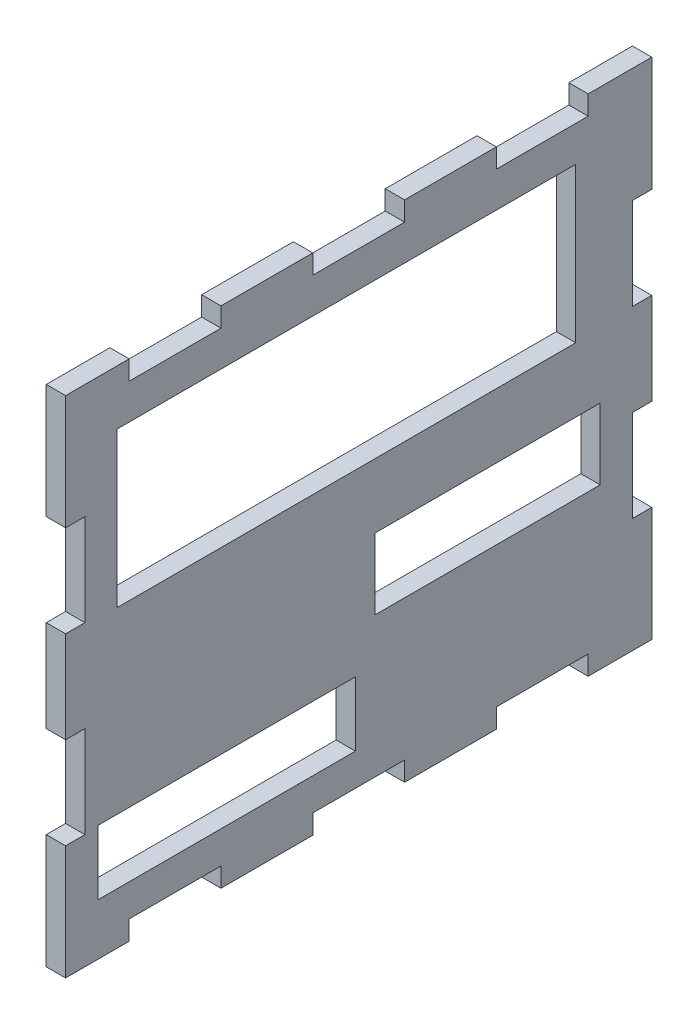
from build123d import *

# Parameters (mm, degrees)
BOSS_EXTRUDE1_DEPTH = 3
SKETCH2_W           = 71.2
SKETCH2_H           = 24
SKETCH2_W_2         = 35
SKETCH2_H_2         = 11
SKETCH2_W_3         = 40
SKETCH2_H_3         = 10
CUT_EXTRUDE1_DEPTH  = 3


with BuildPart() as part:
    # Sketch1 → Boss-Extrude1 (new body)
    with BuildSketch(Plane(origin=(0, 0, 0), x_dir=(0, 0, -1), z_dir=(1, 0, 0))):
        Polygon((-46.800460417, 37.069263333), (-46.800460417, 19.294263333), (-43.800460417, 19.294263333), (-43.800460417, 5.044263333), (-46.800460417, 5.044263333), (-46.800460417, -9.205736667), (-43.800460417, -9.205736667), (-43.800460417, -23.455736667), (-46.800460417, -23.455736667), (-46.800460417, -37.705736667), (-46.800460417, -41.230736667), (-36.925460417, -41.230736667), (-36.925460417, -38.230736667), (-22.675460417, -38.230736667), (-22.675460417, -41.230736667), (-8.425460417, -41.230736667), (-8.425460417, -38.230736667), (5.824539583, -38.230736667), (5.824539583, -41.230736667), (20.074539583, -41.230736667), (20.074539583, -38.230736667), (34.324539583, -38.230736667), (34.324539583, -41.230736667), (44.199539583, -41.230736667), (44.199539583, -23.455736667), (41.199539583, -23.455736667), (41.199539583, -9.205736667), (44.199539583, -9.205736667), (44.199539583, 5.044263333), (41.199539583, 5.044263333), (41.199539583, 19.294263333), (44.199539583, 19.294263333), (44.199539583, 33.544263333), (44.199539583, 37.069263333), (34.324539583, 37.069263333), (34.324539583, 34.069263333), (20.074539583, 34.069263333), (20.074539583, 37.069263333), (5.824539583, 37.069263333), (5.824539583, 34.069263333), (-8.425460417, 34.069263333), (-8.425460417, 37.069263333), (-22.675460417, 37.069263333), (-22.675460417, 34.069263333), (-36.925460417, 34.069263333), (-36.925460417, 37.069263333), align=None)
    extrude(amount=BOSS_EXTRUDE1_DEPTH)

    # Sketch2 → Cut-Extrude1 (cut)
    with BuildSketch(Plane(origin=(3, 0, 0), x_dir=(0, 0, -1), z_dir=(1, 0, 0))):
        with Locations((-3.200460417, 16.569263333)):
            Rectangle(SKETCH2_W, SKETCH2_H)
        with Locations((18.699539583, -10.930736667)):
            Rectangle(SKETCH2_W_2, SKETCH2_H_2)
        with Locations((-21.800460417, -28.230736667)):
            Rectangle(SKETCH2_W_3, SKETCH2_H_3)
    extrude(amount=-CUT_EXTRUDE1_DEPTH, mode=Mode.SUBTRACT)


solid = part.part
